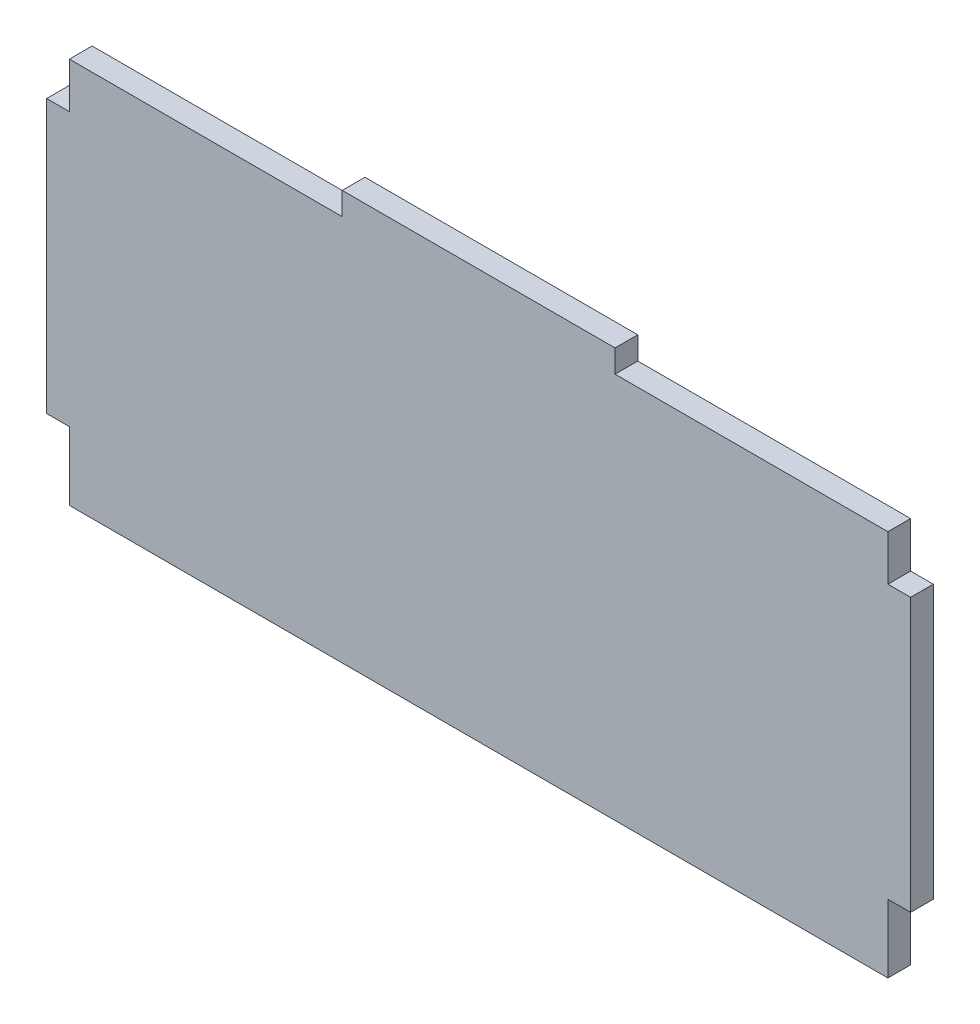
from build123d import *

# Parameters (mm, degrees)
BOSS_EXTRUDE1_DEPTH = 6.35


with BuildPart() as part:
    # Sketch1 → Boss-Extrude1 (new body)
    with BuildSketch(Plane.XY):
        Polygon((26.633678216, 19.051893638), (-49.566321784, 19.051893638), (-49.566321784, 6.351893638), (-55.916321784, 6.351893638), (-55.916321784, -69.848106362), (-49.566321784, -69.848106362), (-49.566321784, -88.898106362), (179.033678216, -88.898106362), (179.033678216, -69.848106362), (185.383678216, -69.848106362), (185.383678216, 6.351893638), (179.033678216, 6.351893638), (179.033678216, 19.051893638), (102.833678216, 19.051893638), (102.833678216, 25.401893638), (26.633678216, 25.401893638), align=None)
    extrude(amount=BOSS_EXTRUDE1_DEPTH)


solid = part.part
